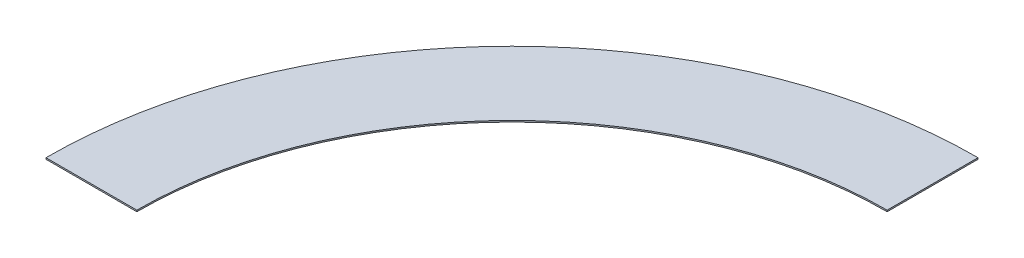
from build123d import *

# Parameters (mm, degrees)
SM_BASE_FLANGE_1_DEPTH = 3


# Sheet-metal steps are written as plain solids
with BuildPart() as part:
    # Sketch 1 → 基体-法兰1 (new body)
    with BuildSketch(Plane(origin=(0, 2989, 0), x_dir=(1, 0, 0), z_dir=(0, 1, 0))):
        with BuildLine():
            Line((-780.5, 0), (-969.5, 0))
            ThreePointArc((-969.5, 0), (-685.54002436, 685.54002436), (0, 969.5))
            Line((0, 969.5), (0, 780.5))
            ThreePointArc((0, 780.5), (-551.896842716, 551.896842716), (-780.5, 0))
        make_face()
    extrude(amount=-SM_BASE_FLANGE_1_DEPTH)


solid = part.part
